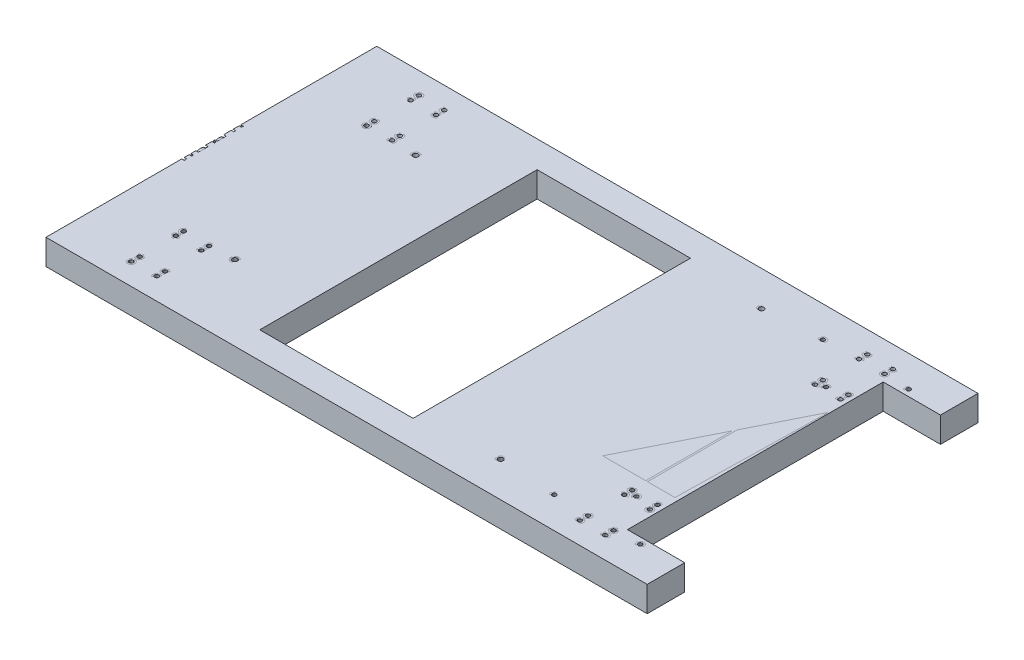
from build123d import *

# Parameters (mm, degrees)
SKETCH1_W                   = 600.075
SKETCH1_H                   = 330.2
BOSS_EXTRUDE1_DEPTH         = 25.4
CUT_EXTRUDE1_DEPTH          = 2.54
CUT_EXTRUDE2_DEPTH          = 2.54
CUT_EXTRUDE3_REACH          = 345.403
SKETCH4_W                   = 153.035
SKETCH4_H                   = 276.86
F_21_0_159_DIAMETER_HOLE1_D = 4.0386
MIRROR4_COPY_1_D            = 4.0386
MIRROR4_COPY_2_D            = 4.0386
F_5_0MM_DOWEL_HOLE2_D       = 5
CUT_EXTRUDE4_REACH          = 345.403
SKETCH18_W                  = 57.15
SKETCH18_H                  = 255.27
CUT_EXTRUDE5_DEPTH          = 12.7
CUT_EXTRUDE5_DEPTH_BACK     = 12.7
SKETCH19_R                  = 2.032
CUT_EXTRUDE6_REACH          = 345.403
SKETCH20_R                  = 2.0193
CUT_EXTRUDE7_REACH          = 345.403
SKETCH21_R                  = 2.0193
LPATTERN1_COUNT             = 2
LPATTERN1_PITCH             = 447.675
MIRROR5_COPY_1_REACH        = 345.403
MIRROR5_COPY_1_SKETCH_R     = 2.0193
MIRROR5_COPY_2_REACH        = 345.403
MIRROR5_COPY_2_SKETCH_R     = 2.0193
MIRROR5_COPY_3_REACH        = 345.403
MIRROR5_COPY_3_SKETCH_R     = 2.0193
MIRROR5_COPY_4_REACH        = 345.403
MIRROR5_COPY_4_SKETCH_R     = 2.0193
CUT_EXTRUDE8_REACH          = 345.403
SKETCH22_R                  = 2.032
SKETCH23_R                  = 3.6068
SKETCH23_R_2                = 2.0193
BOSS_EXTRUDE2_DEPTH         = 26.67
BOSS_EXTRUDE2_2_DEPTH       = 26.67
BOSS_EXTRUDE2_3_DEPTH       = 26.67
BOSS_EXTRUDE2_4_DEPTH       = 26.67
BOSS_EXTRUDE2_5_DEPTH       = 26.67
BOSS_EXTRUDE2_6_DEPTH       = 26.67
BOSS_EXTRUDE2_7_DEPTH       = 26.67
BOSS_EXTRUDE2_8_DEPTH       = 26.67
SKETCH23_R_3                = 4.08813
SKETCH23_R_4                = 2.50063
BOSS_EXTRUDE2_9_DEPTH       = 26.67
BOSS_EXTRUDE2_10_DEPTH      = 26.67
SKETCH23_R_5                = 3.6195
SKETCH23_R_6                = 2.032
BOSS_EXTRUDE2_11_DEPTH      = 26.67
BOSS_EXTRUDE2_12_DEPTH      = 26.67
BOSS_EXTRUDE2_13_DEPTH      = 26.67
BOSS_EXTRUDE2_14_DEPTH      = 26.67
BOSS_EXTRUDE2_15_DEPTH      = 26.67
BOSS_EXTRUDE2_16_DEPTH      = 26.67
BOSS_EXTRUDE2_17_DEPTH      = 26.67
BOSS_EXTRUDE2_18_DEPTH      = 26.67
BOSS_EXTRUDE2_19_DEPTH      = 26.67
BOSS_EXTRUDE2_20_DEPTH      = 26.67
BOSS_EXTRUDE2_21_DEPTH      = 26.67
SKETCH24_W                  = 76.2
SKETCH24_H                  = 152.4
BOSS_EXTRUDE3_DEPTH         = 25.4


with BuildPart() as part:
    # Sketch1 → Boss-Extrude1 (new body)
    with BuildSketch(Plane(origin=(0, 0, 0), x_dir=(1, 0, 0), z_dir=(0, 1, 0))):
        Rectangle(SKETCH1_W, SKETCH1_H)
    extrude(amount=BOSS_EXTRUDE1_DEPTH)

    # Sketch2 → Cut-Extrude1 (cut)
    # profile 1 of 4: a face of its own
    with BuildSketch(Plane.ZY.offset(300.0375)):
        with BuildLine():
            Line((-29.307692308, 31.75), (-25.590805288, 31.75))
            add(Edge.make_bspline(
                [(-25.590805288, 31.75), (-25.408858857, 31.749043416), (-25.056201391, 31.747189317), (-24.543378429, 31.718433989), (-24.06305276, 31.679225443), (-23.615085084, 31.617013082), (-23.199682404, 31.541946409), (-22.815592836, 31.45104081), (-22.464037755, 31.342038813), (-22.044324147, 31.168704053), (-21.56578455, 30.911130809), (-21.047633298, 30.530519618), (-20.604561653, 30.06497864), (-20.222547555, 29.53983733), (-19.918830032, 28.962155487), (-19.699105714, 28.345701902), (-19.559997849, 27.69842785), (-19.545691658, 27.254055696), (-19.538461538, 27.029477163)],
                knots=[0, 0, 0, 0, 1.001505555, 1.941167018, 2.826882275, 3.653841531, 4.429895133, 5.150066043, 5.825578002, 6.45369114, 7.647487171, 8.808567382, 9.977351308, 11.170798116, 12.373658725, 13.556498008, 14.765093433, 16, 16, 16, 16], degree=3))
            add(Edge.make_bspline(
                [(-19.538461538, 27.029477163), (-19.54441177, 26.819096825), (-19.556104537, 26.405679619), (-19.667915841, 25.801010253), (-19.842961765, 25.225421476), (-20.08628605, 24.681013921), (-20.402526915, 24.180088113), (-20.777312907, 23.718603136), (-21.229488074, 23.316098097), (-21.568269138, 23.091074585), (-21.740354567, 22.976772837)],
                knots=[0, 0, 0, 0, 1.044552857, 2.05264487, 3.044412934, 4.028983338, 5.005914585, 5.980388656, 6.974128949, 8, 8, 8, 8], degree=3))
            add(Edge.make_bspline(
                [(-21.740354567, 22.976772837), (-21.52394424, 22.893687628), (-21.109897675, 22.734725042), (-20.540106664, 22.453680588), (-20.049189008, 22.147998245), (-19.633370256, 21.814177746), (-19.277746735, 21.454356933), (-18.967215724, 21.063259811), (-18.702249959, 20.635784572), (-18.475212475, 20.176388187), (-18.298054246, 19.689761552), (-18.165379681, 19.180469185), (-18.08935685, 18.65033732), (-18.078538403, 18.289555469), (-18.073076923, 18.107421875)],
                knots=[0, 0, 0, 0, 1.27268992, 2.434971085, 3.483601985, 4.442670788, 5.356604649, 6.2567628, 7.179492994, 8.113709626, 9.066344395, 10.018646069, 10.999752585, 12, 12, 12, 12], degree=3))
            add(Edge.make_bspline(
                [(-18.073076923, 18.107421875), (-18.078393756, 17.921456471), (-18.088854775, 17.555564329), (-18.166034336, 17.018054239), (-18.296712475, 16.504384887), (-18.476714, 16.011233821), (-18.711640313, 15.539555089), (-18.997542519, 15.088814324), (-19.338437172, 14.663540324), (-19.719779359, 14.259007461), (-20.151191894, 13.895273362), (-20.616641931, 13.571337873), (-21.121991186, 13.304931449), (-21.658939897, 13.081142817), (-22.233511389, 12.910197923), (-22.84312558, 12.790604342), (-23.487256709, 12.710022641), (-23.929269783, 12.703397568), (-24.155949519, 12.7)],
                knots=[0, 0, 0, 0, 0.978564426, 1.925352924, 2.850884081, 3.763762016, 4.682927383, 5.618979971, 6.567305752, 7.547517671, 8.540179244, 9.531824382, 10.526200242, 11.540722885, 12.589160233, 13.674978461, 14.80764778, 16, 16, 16, 16], degree=3))
            Line((-24.155949519, 12.7), (-29.307692308, 12.7))
            Line((-29.307692308, 12.7), (-29.307692308, 31.75))
        make_face()
        with BuildLine():
            Line((-27.598076923, 29.796153846), (-27.598076923, 23.690384615))
            Line((-27.598076923, 23.690384615), (-26.449429087, 23.690384615))
            add(Edge.make_bspline(
                [(-26.449429087, 23.690384615), (-26.2815235, 23.692561339), (-25.957095691, 23.696767213), (-25.487268825, 23.70881507), (-25.051159798, 23.742550135), (-24.649521392, 23.776275504), (-24.28298609, 23.831110046), (-23.952365929, 23.896381458), (-23.652472137, 23.965412698), (-23.306635468, 24.082812334), (-22.914352706, 24.256317966), (-22.496161096, 24.525586103), (-22.127492054, 24.846302939), (-21.816175933, 25.216368031), (-21.561387786, 25.623853986), (-21.384420279, 26.062259149), (-21.264420061, 26.520657296), (-21.25358044, 26.835353787), (-21.248076923, 26.995132212)],
                knots=[0, 0, 0, 0, 1.156816544, 2.235205308, 3.236616184, 4.169592532, 5.011045266, 5.787822928, 6.49130361, 7.128639758, 8.301311294, 9.436451833, 10.541879658, 11.654887649, 12.756523258, 13.837046038, 14.901820046, 16, 16, 16, 16], degree=3))
            add(Edge.make_bspline(
                [(-21.248076923, 26.995132212), (-21.250940847, 27.100863911), (-21.256558745, 27.308268185), (-21.302568864, 27.610615384), (-21.380769519, 27.894970665), (-21.481213601, 28.165230894), (-21.621577749, 28.412945393), (-21.786841743, 28.646679073), (-21.986516714, 28.858472175), (-22.213795801, 29.056426159), (-22.475099877, 29.231928517), (-22.770273051, 29.385638957), (-23.103308837, 29.509413755), (-23.468594519, 29.617814528), (-23.871752866, 29.693950813), (-24.308131507, 29.757378537), (-24.781304763, 29.789669604), (-25.108665964, 29.793944222), (-25.277884615, 29.796153846)],
                knots=[0, 0, 0, 0, 0.91205012, 1.789085906, 2.630437955, 3.453916878, 4.269457761, 5.079663411, 5.91843418, 6.774407191, 7.675494373, 8.627863946, 9.638891023, 10.736472738, 11.911756761, 13.175263542, 14.539845004, 16, 16, 16, 16], degree=3))
            Line((-25.277884615, 29.796153846), (-27.598076923, 29.796153846))
        make_face(mode=Mode.SUBTRACT)
        with BuildLine():
            Line((-27.598076923, 21.736538462), (-27.598076923, 14.653846154))
            Line((-27.598076923, 14.653846154), (-25.163401442, 14.653846154))
            add(Edge.make_bspline(
                [(-25.163401442, 14.653846154), (-24.989127003, 14.655934836), (-24.653235995, 14.659960496), (-24.168270728, 14.673102571), (-23.718782692, 14.702996243), (-23.306822982, 14.750054368), (-22.927943233, 14.801099927), (-22.586688592, 14.869741327), (-22.280292782, 14.948384955), (-21.92501405, 15.069946664), (-21.524944954, 15.258794599), (-21.093811579, 15.54353346), (-20.710491735, 15.882750321), (-20.384980252, 16.275348582), (-20.118209558, 16.70223909), (-19.924142009, 17.154787352), (-19.804448918, 17.625515723), (-19.78995911, 17.946463115), (-19.782692308, 18.107421875)],
                knots=[0, 0, 0, 0, 1.160039823, 2.235823828, 3.228722157, 4.157150951, 4.99529583, 5.772374946, 6.472645482, 7.099169577, 8.269452708, 9.405989375, 10.527446681, 11.663510218, 12.788923519, 13.866172445, 14.929861265, 16, 16, 16, 16], degree=3))
            add(Edge.make_bspline(
                [(-19.782692308, 18.107421875), (-19.784195104, 18.208078486), (-19.787176457, 18.407768106), (-19.832137804, 18.701224208), (-19.897527581, 18.985482176), (-19.982062957, 19.261313877), (-20.105177485, 19.523732397), (-20.248904537, 19.777927757), (-20.417423023, 20.024235981), (-20.680009126, 20.335634103), (-21.061945213, 20.694410988), (-21.604634948, 21.045679393), (-22.22170417, 21.328968171), (-22.669256667, 21.449252464), (-22.900450721, 21.511388221)],
                knots=[0, 0, 0, 0, 0.723448775, 1.435228256, 2.130040452, 2.821711965, 3.505591119, 4.210454504, 4.921174351, 5.648778258, 7.137944449, 8.670945889, 10.280296675, 12, 12, 12, 12], degree=3))
            add(Edge.make_bspline(
                [(-22.900450721, 21.511388221), (-22.993137657, 21.53019375), (-23.194102053, 21.570968014), (-23.521803312, 21.614008514), (-23.895922827, 21.652353768), (-24.317324487, 21.680717355), (-24.786541451, 21.710035542), (-25.304575823, 21.721437354), (-25.869312064, 21.73504047), (-26.261156262, 21.736026358), (-26.46469351, 21.736538462)],
                knots=[0, 0, 0, 0, 0.634451884, 1.375622551, 2.216452059, 3.157844607, 4.20941857, 5.370758133, 6.634282058, 8, 8, 8, 8], degree=3))
            Line((-26.46469351, 21.736538462), (-27.598076923, 21.736538462))
        make_face(mode=Mode.SUBTRACT)
    # profile 2 of 4: a face of its own
    with BuildSketch(Plane.ZY.offset(300.0375)):
        with BuildLine():
            Line((-0.488461538, 26.621153846), (-0.488461538, 12.7))
            Line((-0.488461538, 12.7), (-2.198076923, 12.7))
            Line((-2.198076923, 12.7), (-2.198076923, 15.10796274))
            add(Edge.make_bspline(
                [(-2.198076923, 15.10796274), (-2.390856341, 14.89003295), (-2.767067798, 14.464740225), (-3.395397312, 13.909121543), (-4.061429823, 13.449862393), (-4.761932728, 13.078932138), (-5.496273452, 12.800301088), (-6.262824156, 12.602256422), (-7.061897529, 12.474927119), (-7.607556774, 12.462212486), (-7.884074519, 12.455769231)],
                knots=[0, 0, 0, 0, 1.074387032, 2.096679803, 3.090159297, 4.057316773, 5.018401886, 5.985159533, 6.978961417, 8, 8, 8, 8], degree=3))
            add(Edge.make_bspline(
                [(-7.884074519, 12.455769231), (-8.129917239, 12.4624442), (-8.614729969, 12.475607534), (-9.327902517, 12.577728073), (-10.014204618, 12.741724742), (-10.674284792, 12.969785298), (-11.303871755, 13.27230377), (-11.908355995, 13.634478277), (-12.484605933, 14.065774795), (-13.023838167, 14.558832492), (-13.520400912, 15.094382351), (-13.956162981, 15.66558597), (-14.319490459, 16.269973367), (-14.623311184, 16.89989239), (-14.857334144, 17.560192167), (-15.020476354, 18.248589324), (-15.122477928, 18.964269921), (-15.135635821, 19.451620754), (-15.142307692, 19.698737981)],
                knots=[0, 0, 0, 0, 1.033919861, 2.038935746, 3.024066025, 3.998881131, 4.97069526, 5.957263378, 6.95902576, 7.993208707, 9.027059324, 10.027763471, 11.009749337, 11.988697705, 12.965288445, 13.950418724, 14.960734635, 16, 16, 16, 16], degree=3))
            add(Edge.make_bspline(
                [(-15.142307692, 19.698737981), (-15.135487948, 19.940747567), (-15.122005682, 20.419187465), (-15.021567442, 21.122832949), (-14.852670095, 21.800568054), (-14.615645381, 22.450210845), (-14.311705598, 23.072547404), (-13.941982724, 23.668017883), (-13.50645006, 24.238262746), (-13.004333387, 24.769873281), (-12.46040271, 25.260931195), (-11.87851376, 25.687700429), (-11.273141329, 26.056273563), (-10.634895514, 26.34830177), (-9.97322313, 26.584571324), (-9.282233661, 26.748036479), (-8.564802068, 26.844360471), (-8.077718104, 26.85830923), (-7.830649038, 26.865384615)],
                knots=[0, 0, 0, 0, 1.020392517, 2.01726096, 2.990465484, 3.961182959, 4.928053699, 5.906110375, 6.912531644, 7.948652711, 8.985773172, 9.998621852, 10.987621588, 11.969261332, 12.953316658, 13.946091881, 14.958173133, 16, 16, 16, 16], degree=3))
            add(Edge.make_bspline(
                [(-7.830649038, 26.865384615), (-7.546532663, 26.857559139), (-6.989393859, 26.84221375), (-6.174445694, 26.714509477), (-5.403495036, 26.498762962), (-4.670590634, 26.205297723), (-3.978364329, 25.815323926), (-3.333369514, 25.32339871), (-2.728855955, 24.732624535), (-2.378443224, 24.278851116), (-2.198076923, 24.045282452)],
                knots=[0, 0, 0, 0, 1.038897134, 2.037228247, 3.008116434, 3.962042015, 4.918381754, 5.904844433, 6.921570401, 8, 8, 8, 8], degree=3))
            Line((-2.198076923, 24.045282452), (-2.198076923, 26.621153846))
            Line((-2.198076923, 26.621153846), (-0.488461538, 26.621153846))
        make_face()
        with BuildLine():
            add(Edge.make_bspline(
                [(-7.807752404, 25.155769231), (-8.057657586, 25.146877574), (-8.550930666, 25.129326858), (-9.275070162, 24.99231112), (-9.968018888, 24.764339256), (-10.626311092, 24.452562051), (-11.2395481, 24.060519928), (-11.787609365, 23.586330684), (-12.274977497, 23.042932079), (-12.684869621, 22.432776306), (-13.019009325, 21.778664125), (-13.253961313, 21.094908255), (-13.40891536, 20.393841163), (-13.424746022, 19.918338544), (-13.432692308, 19.679657452)],
                knots=[0, 0, 0, 0, 1.031046209, 2.035121221, 3.029706178, 4.034933723, 5.034054252, 6.02443088, 7.017295772, 8.038157696, 9.050218397, 10.03989886, 11.016116709, 12, 12, 12, 12], degree=3))
            add(Edge.make_bspline(
                [(-13.432692308, 19.679657452), (-13.42254196, 19.442402726), (-13.40228105, 18.968823232), (-13.256680842, 18.266800378), (-13.012406102, 17.582883378), (-12.679074304, 16.922877113), (-12.261679961, 16.310097938), (-11.777871723, 15.756340985), (-11.222970906, 15.280147655), (-10.608322618, 14.881526004), (-9.951870665, 14.559512855), (-9.261531695, 14.33545416), (-8.550282864, 14.190795097), (-8.066672304, 14.173897873), (-7.823016827, 14.165384615)],
                knots=[0, 0, 0, 0, 0.979072187, 1.954306742, 2.945804271, 3.96968567, 4.997920485, 5.998718438, 6.996577872, 8.005894225, 9.015743152, 10.005417472, 10.995077863, 12, 12, 12, 12], degree=3))
            add(Edge.make_bspline(
                [(-7.823016827, 14.165384615), (-7.575658005, 14.174419562), (-7.083685841, 14.192389174), (-6.357398017, 14.32999149), (-5.652575433, 14.557333092), (-4.978819233, 14.872469768), (-4.351170005, 15.263034805), (-3.787845843, 15.7202734), (-3.311508929, 16.252057874), (-2.907689154, 16.836492568), (-2.591048672, 17.477182149), (-2.360401835, 18.159358244), (-2.224037005, 18.883044602), (-2.206849934, 19.377603976), (-2.198076923, 19.630048077)],
                knots=[0, 0, 0, 0, 1.01762866, 2.023962475, 3.030623092, 4.058876274, 5.077231937, 6.066672613, 7.034107872, 8.005628644, 8.981990164, 9.965428785, 10.961468474, 12, 12, 12, 12], degree=3))
            add(Edge.make_bspline(
                [(-2.198076923, 19.630048077), (-2.203300196, 19.82238684), (-2.213581249, 20.200970393), (-2.292124777, 20.756835882), (-2.417065163, 21.28878659), (-2.593120745, 21.797381798), (-2.824394736, 22.279809525), (-3.103329005, 22.739533705), (-3.434828667, 23.174163327), (-3.813557341, 23.577713471), (-4.228113658, 23.945794644), (-4.666778229, 24.274348583), (-5.134748266, 24.544253188), (-5.624153853, 24.767634966), (-6.135844116, 24.945394053), (-6.673982775, 25.063981358), (-7.232849833, 25.145408248), (-7.614100506, 25.152279207), (-7.807752404, 25.155769231)],
                knots=[0, 0, 0, 0, 1.050140795, 2.067009409, 3.05949893, 4.030605086, 5.00011959, 5.97591094, 6.962425594, 7.979863591, 8.993523472, 9.986985069, 10.967611495, 11.937549037, 12.921786183, 13.919465291, 14.943216303, 16, 16, 16, 16], degree=3))
        make_face(mode=Mode.SUBTRACT)
    # profile 3 of 4: a face of its own
    with BuildSketch(Plane.ZY.offset(300.0375)):
        with BuildLine():
            Line((17.096153846, 23.602614183), (15.665114183, 22.713461538))
            add(Edge.make_bspline(
                [(15.665114183, 22.713461538), (15.508197344, 22.908470368), (15.199333188, 23.29231214), (14.662998202, 23.787666205), (14.091436076, 24.213118247), (13.474879845, 24.559848662), (12.814194276, 24.827753985), (12.111984871, 25.017329818), (11.368351766, 25.135462911), (10.858545469, 25.148889552), (10.597325721, 25.155769231)],
                knots=[0, 0, 0, 0, 1.026593902, 2.0206758, 2.988051866, 3.946915611, 4.916868779, 5.907761954, 6.927957743, 8, 8, 8, 8], degree=3))
            add(Edge.make_bspline(
                [(10.597325721, 25.155769231), (10.388543399, 25.15001699), (9.977352291, 25.138688107), (9.373705942, 25.06787385), (8.798709705, 24.939193777), (8.248759561, 24.769643569), (7.727766997, 24.542402706), (7.234366998, 24.265852462), (6.764183117, 23.944451528), (6.330840568, 23.572102702), (5.934442686, 23.167161383), (5.591004311, 22.733073412), (5.291990432, 22.282840861), (5.05737087, 21.805220664), (4.865373156, 21.311139575), (4.739062293, 20.791271303), (4.654890166, 20.252276005), (4.645259963, 19.884783327), (4.640384615, 19.698737981)],
                knots=[0, 0, 0, 0, 1.112346261, 2.190735716, 3.231507886, 4.247384806, 5.251966152, 6.253067467, 7.256802811, 8.280671706, 9.291813951, 10.270744147, 11.225547591, 12.165006084, 13.100104208, 14.043489273, 15.009504848, 16, 16, 16, 16], degree=3))
            add(Edge.make_bspline(
                [(4.640384615, 19.698737981), (4.650068831, 19.455065561), (4.669306776, 18.971003995), (4.820081864, 18.256476041), (5.066884995, 17.565648526), (5.404657011, 16.903426237), (5.831796842, 16.290592335), (6.333478937, 15.740953819), (6.909981376, 15.265160865), (7.55622449, 14.870703265), (8.257034494, 14.553594964), (9.004829207, 14.32767648), (9.793498012, 14.191319996), (10.333466164, 14.174142648), (10.608774038, 14.165384615)],
                knots=[0, 0, 0, 0, 0.966302908, 1.919585723, 2.883856336, 3.870342332, 4.860282998, 5.839159637, 6.814385684, 7.815993281, 8.834850808, 9.858348828, 10.908058873, 12, 12, 12, 12], degree=3))
            add(Edge.make_bspline(
                [(10.608774038, 14.165384615), (10.861078685, 14.172457593), (11.356924268, 14.186357871), (12.081734777, 14.303536943), (12.77177972, 14.495363006), (13.427034572, 14.762866644), (14.046301991, 15.108637837), (14.625580785, 15.53513561), (15.176397592, 16.030090535), (15.500231136, 16.412821207), (15.665114183, 16.607692308)],
                knots=[0, 0, 0, 0, 1.039848629, 2.043578496, 3.018386758, 3.987534228, 4.954977003, 5.934852016, 6.948509513, 8, 8, 8, 8], degree=3))
            Line((15.665114183, 16.607692308), (17.096153846, 15.668930288))
            add(Edge.make_bspline(
                [(17.096153846, 15.668930288), (17.01131221, 15.544339332), (16.841910537, 15.295570952), (16.558731604, 14.944810831), (16.253279378, 14.616488532), (15.926745522, 14.311044151), (15.583393711, 14.021168361), (15.21149466, 13.760719077), (14.823040061, 13.515056685), (14.413469645, 13.294006623), (13.987017989, 13.09530793), (13.544285159, 12.924450272), (13.087195036, 12.777655839), (12.615210189, 12.660975423), (12.127400113, 12.567843573), (11.625026389, 12.506046998), (11.108262038, 12.459917253), (10.758982186, 12.457163892), (10.582061298, 12.455769231)],
                knots=[0, 0, 0, 0, 0.954134338, 1.905101784, 2.851144739, 3.791306361, 4.734911809, 5.6936923, 6.663572882, 7.643865596, 8.638447847, 9.640600242, 10.646758161, 11.676244097, 12.717260333, 13.78922464, 14.880174919, 16, 16, 16, 16], degree=3))
            add(Edge.make_bspline(
                [(10.582061298, 12.455769231), (10.312036345, 12.460620339), (9.782785478, 12.470128548), (9.008144401, 12.574677535), (8.267841441, 12.732289704), (7.562129521, 12.95851517), (6.890898775, 13.249734018), (6.254775089, 13.605462367), (5.655864761, 14.028654252), (5.100090358, 14.511777326), (4.589651344, 15.035601386), (4.151358793, 15.600841653), (3.771200963, 16.186716499), (3.465924479, 16.806165491), (3.222917636, 17.45095559), (3.05688419, 18.126252182), (2.949498047, 18.826488022), (2.937069938, 19.304005566), (2.930769231, 19.54609375)],
                knots=[0, 0, 0, 0, 1.1129367, 2.181364009, 3.217532258, 4.231199276, 5.232079859, 6.230262199, 7.231623845, 8.250719726, 9.263571943, 10.242672461, 11.195837495, 12.138959767, 13.085126421, 14.0317438, 15.002148558, 16, 16, 16, 16], degree=3))
            add(Edge.make_bspline(
                [(2.930769231, 19.54609375), (2.933169619, 19.710350658), (2.937944386, 20.037084759), (2.992710021, 20.522016479), (3.063458853, 21.000490133), (3.183341793, 21.46644072), (3.321811517, 21.926935227), (3.498571197, 22.37642325), (3.705918989, 22.816993541), (3.94133316, 23.247511183), (4.206339044, 23.660893677), (4.499606899, 24.051438623), (4.810091072, 24.423837632), (5.152316767, 24.765234101), (5.511761169, 25.089281085), (5.898593602, 25.387321733), (6.310595309, 25.660231984), (6.741578822, 25.913058225), (7.191293322, 26.138171722), (7.657020485, 26.332118345), (8.135953973, 26.497867365), (8.628859901, 26.629088769), (9.132466643, 26.739129316), (9.650742783, 26.808350736), (10.181705592, 26.857261736), (10.541239087, 26.862654476), (10.723257212, 26.865384615)],
                knots=[0, 0, 0, 0, 0.990994727, 1.971252077, 2.943264845, 3.907940874, 4.872158414, 5.844625996, 6.82015047, 7.809835459, 8.804511986, 9.781214284, 10.756496977, 11.728388426, 12.696359165, 13.676225489, 14.672885716, 15.677705647, 16.690706858, 17.706033469, 18.721040654, 19.747369689, 20.783475414, 21.830280724, 22.901553713, 24, 24, 24, 24], degree=3))
            add(Edge.make_bspline(
                [(10.723257212, 26.865384615), (10.951204657, 26.860366894), (11.405960159, 26.850356532), (12.080551719, 26.766108439), (12.745207275, 26.639091659), (13.388265081, 26.450916685), (14.001928252, 26.223058788), (14.576342631, 25.967175299), (15.097986625, 25.670024672), (15.576563932, 25.344976621), (16.01296959, 24.978340834), (16.411683328, 24.565734395), (16.780881305, 24.109304673), (16.990195691, 23.772904907), (17.096153846, 23.602614183)],
                knots=[0, 0, 0, 0, 1.095225653, 2.184976855, 3.262915854, 4.344593502, 5.400796181, 6.407717688, 7.363229445, 8.282371371, 9.184954523, 10.097238608, 11.036792983, 12, 12, 12, 12], degree=3))
        make_face()
    # profile 4 of 4: a face of its own
    with BuildSketch(Plane.ZY.offset(300.0375)):
        Polygon((20.515384615, 32.238461538), (22.225, 32.238461538), (22.225, 20.942788462), (28.559735577, 26.621153846), (31.017307692, 26.621153846), (23.667487981, 20.026923077), (31.75, 12.7), (29.29624399, 12.7), (22.225, 19.114873798), (22.225, 12.7), (20.515384615, 12.7), align=None)
    extrude(amount=-CUT_EXTRUDE1_DEPTH, mode=Mode.SUBTRACT)

    # Sketch3 → Cut-Extrude2 (cut)
    # profile 1 of 5: a face of its own
    with BuildSketch(Plane(origin=(300.0375, 0, 0), x_dir=(0, 0, -1), z_dir=(1, 0, 0))):
        Polygon((-28.941346154, 31.75), (-19.660576923, 31.75), (-19.660576923, 29.796153846), (-27.231730769, 29.796153846), (-27.231730769, 23.934615385), (-19.660576923, 23.934615385), (-19.660576923, 21.980769231), (-27.231730769, 21.980769231), (-27.231730769, 12.7), (-28.941346154, 12.7), align=None)
    # profile 2 of 5: a face of its own
    with BuildSketch(Plane(origin=(300.0375, 0, 0), x_dir=(0, 0, -1), z_dir=(1, 0, 0))):
        with BuildLine():
            Line((-17.218269231, 26.621153846), (-15.508653846, 26.621153846))
            Line((-15.508653846, 26.621153846), (-15.508653846, 24.571905048))
            add(Edge.make_bspline(
                [(-15.508653846, 24.571905048), (-15.382440745, 24.762708914), (-15.14105917, 25.127619824), (-14.739850226, 25.610234162), (-14.32889638, 26.009821773), (-13.906230289, 26.328248068), (-13.468743773, 26.566716615), (-13.026038365, 26.74139442), (-12.571149022, 26.844685236), (-12.265467691, 26.858475579), (-12.112319712, 26.865384615)],
                knots=[0, 0, 0, 0, 1.2804753, 2.448899062, 3.506932113, 4.484331642, 5.4025378, 6.288909075, 7.142734305, 8, 8, 8, 8], degree=3))
            add(Edge.make_bspline(
                [(-12.112319712, 26.865384615), (-11.993522135, 26.858904749), (-11.749088399, 26.845572003), (-11.379068875, 26.751895944), (-10.997832372, 26.602336992), (-10.752128807, 26.461692352), (-10.624038462, 26.388371394)],
                knots=[0, 0, 0, 0, 0.901110191, 1.854092781, 2.881294221, 4, 4, 4, 4], degree=3))
            Line((-10.624038462, 26.388371394), (-11.562800481, 24.907722356))
            add(Edge.make_bspline(
                [(-11.562800481, 24.907722356), (-11.645036724, 24.944408661), (-11.801136858, 25.014046292), (-12.029489568, 25.09646209), (-12.240026558, 25.144990147), (-12.374157926, 25.152341909), (-12.436688702, 25.155769231)],
                knots=[0, 0, 0, 0, 1.180555205, 2.24091978, 3.179933427, 4, 4, 4, 4], degree=3))
            add(Edge.make_bspline(
                [(-12.436688702, 25.155769231), (-12.573879909, 25.146625027), (-12.853710203, 25.127973503), (-13.264561549, 24.981349421), (-13.663235625, 24.744447757), (-13.979855673, 24.481714991), (-14.225014221, 24.228361979), (-14.399948877, 24.007118531), (-14.560419257, 23.75904055), (-14.713745742, 23.488368986), (-14.853443715, 23.190482252), (-14.983825557, 22.868356476), (-15.101711654, 22.521618561), (-15.168932269, 22.280050844), (-15.203365385, 22.156310096)],
                knots=[0, 0, 0, 0, 1.125678352, 2.296057538, 3.5422874, 4.923748041, 5.663163013, 6.437101912, 7.23742474, 8.08941207, 8.991984279, 9.93940061, 10.944477711, 12, 12, 12, 12], degree=3))
            add(Edge.make_bspline(
                [(-15.203365385, 22.156310096), (-15.229123126, 22.045944337), (-15.286174565, 21.801492567), (-15.341645649, 21.391381311), (-15.396452597, 20.906838254), (-15.435078477, 20.346514656), (-15.470881821, 19.711809783), (-15.491075268, 19.001756707), (-15.507965219, 18.21562661), (-15.50841734, 17.66603763), (-15.508653846, 17.378545673)],
                knots=[0, 0, 0, 0, 0.566838948, 1.255505196, 2.06880316, 3.007127437, 4.065329342, 5.249902469, 6.561414163, 8, 8, 8, 8], degree=3))
            Line((-15.508653846, 17.378545673), (-15.508653846, 12.7))
            Line((-15.508653846, 12.7), (-17.218269231, 12.7))
            Line((-17.218269231, 12.7), (-17.218269231, 26.621153846))
        make_face()
    # profile 3 of 5: a face of its own
    with BuildSketch(Plane(origin=(300.0375, 0, 0), x_dir=(0, 0, -1), z_dir=(1, 0, 0))):
        with BuildLine():
            add(Edge.make_bspline(
                [(-2.190444712, 26.865384615), (-1.929235069, 26.859822608), (-1.417066797, 26.848916871), (-0.666998161, 26.732358272), (0.048983221, 26.554119046), (0.733619496, 26.307712401), (1.378142475, 25.977429213), (1.991940247, 25.583315785), (2.573329967, 25.116413383), (2.921798169, 24.755235897), (3.098677885, 24.571905048)],
                knots=[0, 0, 0, 0, 1.054011418, 2.066658804, 3.057071809, 4.030435133, 4.997543892, 5.974964718, 6.972108034, 8, 8, 8, 8], degree=3))
            add(Edge.make_bspline(
                [(3.098677885, 24.571905048), (3.250979663, 24.396568925), (3.552635761, 24.049289917), (3.939436316, 23.486195795), (4.272656522, 22.903047533), (4.53969921, 22.29210137), (4.750256268, 21.658690659), (4.899748129, 21.000638284), (4.988667732, 20.319397509), (5.000658166, 19.856733762), (5.006730769, 19.622415865)],
                knots=[0, 0, 0, 0, 1.025258237, 2.030674902, 3.01204498, 3.988269485, 4.97094183, 5.956517959, 6.965070386, 8, 8, 8, 8], degree=3))
            add(Edge.make_bspline(
                [(5.006730769, 19.622415865), (5.00138949, 19.386739837), (4.990834874, 18.921033014), (4.890993191, 18.235127609), (4.735702566, 17.570038646), (4.513460704, 16.928550613), (4.228482995, 16.308702652), (3.88073511, 15.713202105), (3.467776737, 15.140874065), (2.999669269, 14.596578346), (2.482315486, 14.094930805), (1.921069021, 13.65771551), (1.326959209, 13.283129784), (0.6920861, 12.981397293), (0.022247351, 12.743491639), (-0.684001834, 12.576395835), (-1.425564288, 12.475367242), (-1.931898165, 12.462393793), (-2.190444712, 12.455769231)],
                knots=[0, 0, 0, 0, 0.998656419, 1.973391657, 2.932242238, 3.890759089, 4.846373663, 5.82037756, 6.809684879, 7.83454468, 8.860553229, 9.859544525, 10.845671541, 11.83227036, 12.833544569, 13.85385346, 14.904124723, 16, 16, 16, 16], degree=3))
            add(Edge.make_bspline(
                [(-2.190444712, 12.455769231), (-2.450257971, 12.462416027), (-2.959115364, 12.475434114), (-3.703295352, 12.576003324), (-4.410810277, 12.74341463), (-5.081525935, 12.982179126), (-5.719128602, 13.283139428), (-6.316680821, 13.656583053), (-6.878383219, 14.095060469), (-7.395846448, 14.596543212), (-7.863924571, 15.140883117), (-8.276890517, 15.713199756), (-8.624636435, 16.308703264), (-8.909614659, 16.928550449), (-9.131856383, 17.570038689), (-9.287147045, 18.235127597), (-9.386988718, 18.921033017), (-9.397543336, 19.386739838), (-9.402884615, 19.622415865)],
                knots=[0, 0, 0, 0, 1.099876186, 2.154163076, 3.173186993, 4.173200201, 5.163417411, 6.152872554, 7.150605724, 8.17532212, 9.198891216, 10.186952605, 11.159729845, 12.11414092, 13.071450619, 14.029093627, 15.002601286, 16, 16, 16, 16], degree=3))
            add(Edge.make_bspline(
                [(-9.402884615, 19.622415865), (-9.396770598, 19.855460208), (-9.384665893, 20.316847955), (-9.295835694, 20.9968081), (-9.146926979, 21.653746746), (-8.936117521, 22.284712551), (-8.666613411, 22.892981424), (-8.338075544, 23.477570576), (-7.947329387, 24.038118461), (-7.64687305, 24.38494864), (-7.494831731, 24.560456731)],
                knots=[0, 0, 0, 0, 1.031353054, 2.041901799, 3.029428768, 4.008703097, 4.981709435, 5.96992636, 6.972712378, 8, 8, 8, 8], degree=3))
            add(Edge.make_bspline(
                [(-7.494831731, 24.560456731), (-7.318218685, 24.745377472), (-6.970878055, 25.109056647), (-6.386594265, 25.574597956), (-5.774306468, 25.976912587), (-5.122660798, 26.300633131), (-4.438586957, 26.555568492), (-3.718936509, 26.732817938), (-2.966322632, 26.848496913), (-2.451648122, 26.859699281), (-2.190444712, 26.865384615)],
                knots=[0, 0, 0, 0, 1.027980169, 2.021703884, 2.998553061, 3.971491411, 4.943284454, 5.930300938, 6.949603206, 8, 8, 8, 8], degree=3))
        make_face()
        with BuildLine():
            add(Edge.make_bspline(
                [(-2.198076923, 25.155769231), (-2.382794493, 25.150519096), (-2.747461179, 25.140154358), (-3.28423349, 25.061320534), (-3.800979185, 24.936420547), (-4.298678637, 24.758961327), (-4.775653475, 24.529823034), (-5.232360366, 24.248381817), (-5.670142646, 23.918365296), (-6.080436448, 23.540289898), (-6.45698589, 23.127291371), (-6.786158877, 22.687245303), (-7.066058384, 22.227289333), (-7.299231249, 21.746945155), (-7.472897516, 21.241345016), (-7.599024967, 20.716214723), (-7.677784418, 20.170484385), (-7.688051708, 19.7994937), (-7.693269231, 19.610967548)],
                knots=[0, 0, 0, 0, 1.021534396, 2.016698045, 2.994645724, 3.958388632, 4.93408049, 5.916473867, 6.921342795, 7.962252576, 8.998418191, 10.008913653, 10.997312074, 11.973003931, 12.956656626, 13.948281152, 14.957379055, 16, 16, 16, 16], degree=3))
            add(Edge.make_bspline(
                [(-7.693269231, 19.610967548), (-7.684523519, 19.367388657), (-7.667164917, 18.883930107), (-7.52600313, 18.171943854), (-7.289857807, 17.488419773), (-6.970975613, 16.837364872), (-6.571436052, 16.234991473), (-6.100699303, 15.69793668), (-5.563817505, 15.234282477), (-4.967190554, 14.849576732), (-4.32300491, 14.543907205), (-3.641252648, 14.327287066), (-2.930194013, 14.18647114), (-2.444251748, 14.172474972), (-2.198076923, 14.165384615)],
                knots=[0, 0, 0, 0, 1.016792936, 2.018143844, 3.017858371, 4.030088057, 5.03801393, 6.028138512, 7.003788237, 7.991172063, 8.984598303, 9.972568034, 10.972917682, 12, 12, 12, 12], degree=3))
            add(Edge.make_bspline(
                [(-2.198076923, 14.165384615), (-1.951916258, 14.172516284), (-1.466001943, 14.186593999), (-0.75593128, 14.32657786), (-0.076042376, 14.544856357), (0.567474176, 14.849232956), (1.163829546, 15.235743385), (1.704572621, 15.695318523), (2.171290061, 16.236413914), (2.570434397, 16.838162749), (2.89453881, 17.487410437), (3.129578809, 18.172070008), (3.271079955, 18.883897979), (3.288392751, 19.367377893), (3.297115385, 19.610967548)],
                knots=[0, 0, 0, 0, 1.02726834, 2.027799167, 3.010890988, 4.004497153, 4.992059811, 5.971914811, 6.958719428, 7.966827853, 8.981595046, 9.981490638, 10.983022906, 12, 12, 12, 12], degree=3))
            add(Edge.make_bspline(
                [(3.297115385, 19.610967548), (3.291899658, 19.799494826), (3.281635904, 20.170487729), (3.20285074, 20.716201941), (3.076818446, 21.241391917), (2.902801501, 21.746772106), (2.670641797, 22.228533022), (2.38534468, 22.685894822), (2.057515813, 23.128815737), (1.676422626, 23.538954839), (1.266557098, 23.918512681), (0.82859739, 24.248509786), (0.372567721, 24.528586128), (-0.103021421, 24.760921237), (-0.600784682, 24.934806047), (-1.116806343, 25.062041712), (-1.651288437, 25.139821211), (-2.014648372, 25.150419224), (-2.198076923, 25.155769231)],
                knots=[0, 0, 0, 0, 1.042956736, 2.052379634, 3.044323526, 4.02829302, 5.004299113, 5.996692471, 7.007513377, 8.048758398, 9.090003419, 10.095195979, 11.07790575, 12.047570684, 13.018257071, 13.989683339, 14.985167495, 16, 16, 16, 16], degree=3))
        make_face(mode=Mode.SUBTRACT)
    # profile 4 of 5: a face of its own
    with BuildSketch(Plane(origin=(300.0375, 0, 0), x_dir=(0, 0, -1), z_dir=(1, 0, 0))):
        with BuildLine():
            Line((8.425961538, 26.621153846), (10.135576923, 26.621153846))
            Line((10.135576923, 26.621153846), (10.135576923, 24.11015625))
            add(Edge.make_bspline(
                [(10.135576923, 24.11015625), (10.31811748, 24.337900213), (10.672343799, 24.779845318), (11.262264242, 25.36071016), (11.885710328, 25.839383456), (12.53886409, 26.220948392), (13.222612188, 26.508585029), (13.932786771, 26.716316739), (14.673639671, 26.840875592), (15.177454678, 26.857150988), (15.432331731, 26.865384615)],
                knots=[0, 0, 0, 0, 1.12780773, 2.188550248, 3.19190651, 4.159438251, 5.104880172, 6.052711206, 7.014878035, 8, 8, 8, 8], degree=3))
            add(Edge.make_bspline(
                [(15.432331731, 26.865384615), (15.689945611, 26.855885766), (16.194158114, 26.837294226), (16.928280134, 26.690246236), (17.613935319, 26.439084205), (18.248678902, 26.095029936), (18.820871306, 25.66718613), (19.323382283, 25.168741347), (19.739016529, 24.595412094), (20.017676462, 24.063518915), (20.201240345, 23.591684192), (20.316804925, 23.187569738), (20.414944981, 22.737346658), (20.500026352, 22.242375466), (20.557596061, 21.699188173), (20.603001962, 21.110011449), (20.635543141, 20.475036139), (20.636834225, 20.035870353), (20.6375, 19.809405048)],
                knots=[0, 0, 0, 0, 1.235846778, 2.418850247, 3.575807741, 4.728682307, 5.871620074, 6.994088408, 8.11269785, 9.256955736, 9.865816715, 10.540099792, 11.271859618, 12.076849838, 12.949306005, 13.892391288, 14.913166135, 16, 16, 16, 16], degree=3))
            Line((20.6375, 19.809405048), (20.6375, 12.7))
            Line((20.6375, 12.7), (18.927884615, 12.7))
            Line((18.927884615, 12.7), (18.927884615, 19.2484375))
            add(Edge.make_bspline(
                [(18.927884615, 19.2484375), (18.926833012, 19.437971093), (18.924821473, 19.8005166), (18.918477025, 20.319596569), (18.903183649, 20.79033066), (18.881693545, 21.211593474), (18.850239108, 21.582980499), (18.817458786, 21.905248134), (18.777372269, 22.177987215), (18.741651271, 22.342171449), (18.72563101, 22.415805288)],
                knots=[0, 0, 0, 0, 1.430800155, 2.736877192, 3.918605307, 4.986035426, 5.920637409, 6.731861385, 7.431261377, 8, 8, 8, 8], degree=3))
            add(Edge.make_bspline(
                [(18.72563101, 22.415805288), (18.66779776, 22.631947595), (18.556486646, 23.047954662), (18.281437395, 23.612239353), (17.934105926, 24.09228949), (17.51011906, 24.485137074), (17.013572234, 24.790866914), (16.445843357, 25.002996582), (15.812411041, 25.135673133), (15.36688933, 25.148883666), (15.134675481, 25.155769231)],
                knots=[0, 0, 0, 0, 1.084156227, 2.086665306, 3.027808233, 3.945421172, 4.874247719, 5.839848303, 6.874090471, 8, 8, 8, 8], degree=3))
            add(Edge.make_bspline(
                [(15.134675481, 25.155769231), (14.997147089, 25.153178405), (14.724981954, 25.148051229), (14.32139425, 25.096609164), (13.92992125, 25.012470998), (13.546634112, 24.898885986), (13.179198835, 24.742881349), (12.815810336, 24.565828634), (12.470152091, 24.345130509), (12.134853601, 24.099164412), (11.822908176, 23.826590441), (11.532649649, 23.538965322), (11.273906996, 23.23266525), (11.039490349, 22.912625535), (10.837134372, 22.574450817), (10.66049685, 22.221403663), (10.510623997, 21.853019396), (10.436151057, 21.597340849), (10.398888221, 21.469411058)],
                knots=[0, 0, 0, 0, 1.023777757, 2.026029729, 3.023749952, 4.003683103, 4.997618607, 5.993177895, 7.010360494, 8.046726602, 9.087585522, 10.09234134, 11.086953743, 12.070360549, 13.043493632, 14.017870808, 15.008233677, 16, 16, 16, 16], degree=3))
            add(Edge.make_bspline(
                [(10.398888221, 21.469411058), (10.377445277, 21.375493452), (10.330765109, 21.171039739), (10.280346944, 20.835517971), (10.234585712, 20.447387964), (10.196284552, 20.007102638), (10.172850785, 19.513120489), (10.147299854, 18.967551144), (10.137997679, 18.368219157), (10.136406437, 17.950960515), (10.135576923, 17.73344351)],
                knots=[0, 0, 0, 0, 0.615963638, 1.340920617, 2.168419149, 3.115676021, 4.16674242, 5.331190069, 6.6087489, 8, 8, 8, 8], degree=3))
            Line((10.135576923, 17.73344351), (10.135576923, 12.7))
            Line((10.135576923, 12.7), (8.425961538, 12.7))
            Line((8.425961538, 12.7), (8.425961538, 26.621153846))
        make_face()
    # profile 5 of 5: a face of its own
    with BuildSketch(Plane(origin=(300.0375, 0, 0), x_dir=(0, 0, -1), z_dir=(1, 0, 0))):
        Polygon((26.254807692, 32.238461538), (27.964423077, 32.238461538), (27.964423077, 26.621153846), (30.406730769, 26.621153846), (30.406730769, 24.911538462), (27.964423077, 24.911538462), (27.964423077, 12.7), (26.254807692, 12.7), (26.254807692, 24.911538462), (23.8125, 24.911538462), (23.8125, 26.621153846), (26.254807692, 26.621153846), align=None)
    extrude(amount=-CUT_EXTRUDE2_DEPTH, mode=Mode.SUBTRACT)

    # Sketch4 → Cut-Extrude3 (cut, up to next)
    with BuildSketch(Plane.XZ, mode=Mode.PRIVATE) as cut_extrude3_sk1:
        with Locations((-36.83, 0)):
            Rectangle(SKETCH4_W, SKETCH4_H)
    cut_extrude3_tool1 = extrude(cut_extrude3_sk1.sketch, amount=-CUT_EXTRUDE3_REACH, mode=Mode.PRIVATE) & part.part
    add(cut_extrude3_tool1.solids().sort_by_distance((-36.83, 0, 0))[0], mode=Mode.SUBTRACT)

    # #21 (0.159) Diameter Hole1 (through all)
    with Locations(Plane(origin=(0, 25.4, 0), x_dir=(1, 0, 0), z_dir=(0, 1, 0))):
        with Locations((-236.5375, -91.29776), (-211.1375, -91.29776), (-211.1375, -135.24738), (-236.5375, -135.24738)):
            f_21_0_159_diameter_hole1 = Hole(F_21_0_159_DIAMETER_HOLE1_D / 2)

    # Mirror3: #21 (0.159) Diameter Hole1 across plane
    add(f_21_0_159_diameter_hole1.mirror(Plane(origin=(0, 0, 0), x_dir=(0, 0, 1), z_dir=(1, 0, 0))), mode=Mode.SUBTRACT)

    # Mirror4 copy 1 (through all)
    with Locations(Plane(origin=(0, 25.4, 0), x_dir=(-1, 0, 0), z_dir=(0, 1, 0))):
        with Locations((-236.5375, -91.29776), (-211.1375, -91.29776), (-211.1375, -135.24738), (-236.5375, -135.24738)):
            Hole(MIRROR4_COPY_1_D / 2)

    # Mirror4 copy 2 (through all)
    with Locations(Plane(origin=(0, 25.4, 0), x_dir=(1, 0, 0), z_dir=(0, 1, 0))):
        with Locations((-236.5375, 91.29776), (-211.1375, 91.29776), (-211.1375, 135.24738), (-236.5375, 135.24738)):
            Hole(MIRROR4_COPY_2_D / 2)

    # Ø5.0mm Dowel Hole2 (through all)
    with Locations(Plane(origin=(0, 25.4, 0), x_dir=(1, 0, 0), z_dir=(0, 1, 0))):
        with Locations((118.850833333, -130.175), (118.850833333, 130.175), (-186.3725, 90.17), (-186.3725, -90.17)):
            Hole(F_5_0MM_DOWEL_HOLE2_D / 2)

    # Sketch18 → Cut-Extrude4 (cut, up to next)
    with BuildSketch(Plane(origin=(0, 25.4, 0), x_dir=(1, 0, 0), z_dir=(0, 1, 0)), mode=Mode.PRIVATE) as cut_extrude4_sk1:
        with Locations((271.4625, 0)):
            Rectangle(SKETCH18_W, SKETCH18_H)
    cut_extrude4_tool1 = extrude(cut_extrude4_sk1.sketch, amount=-CUT_EXTRUDE4_REACH, mode=Mode.PRIVATE) & part.part
    add(cut_extrude4_tool1.solids().sort_by_distance((271.4625, 25.4, 0))[0], mode=Mode.SUBTRACT)

    # Sketch19 → Cut-Extrude5 (cut, two sides: drawn at the far end of the back side and taken through both)
    with BuildSketch(Plane(origin=(0, 12.7, 0), x_dir=(-1, 0, 0), z_dir=(0, -1, 0)).offset(-CUT_EXTRUDE5_DEPTH_BACK)):
        with Locations((-218.758629303, 94.615)):
            Circle(SKETCH19_R)
        with Locations((-218.758629303, -94.615)):
            Circle(SKETCH19_R)
        with Locations((-176.2125, 133.985)):
            Circle(SKETCH19_R)
        with Locations((-176.2125, -133.985)):
            Circle(SKETCH19_R)
    extrude(amount=CUT_EXTRUDE5_DEPTH + CUT_EXTRUDE5_DEPTH_BACK, mode=Mode.SUBTRACT)

    # Sketch20 → Cut-Extrude6 (cut, up to next)
    with BuildSketch(Plane(origin=(0, 25.4, 0), x_dir=(1, 0, 0), z_dir=(0, 1, 0)), mode=Mode.PRIVATE) as cut_extrude6_sk1:
        with Locations((236.5375, 143.51)):
            Circle(SKETCH20_R)
    cut_extrude6_tool1 = extrude(cut_extrude6_sk1.sketch, amount=-CUT_EXTRUDE6_REACH, mode=Mode.PRIVATE) & part.part
    cut_extrude6 = cut_extrude6_tool1.solids().sort_by_distance((236.5375, 25.4, -143.51))[0]
    add(cut_extrude6, mode=Mode.SUBTRACT)

    # Sketch21 → Cut-Extrude7 (cut, up to next)
    with BuildSketch(Plane(origin=(0, 25.4, 0), x_dir=(1, 0, 0), z_dir=(0, 1, 0)), mode=Mode.PRIVATE) as cut_extrude7_sk1:
        with Locations((211.1375, 143.51)):
            Circle(SKETCH21_R)
    cut_extrude7_tool1 = extrude(cut_extrude7_sk1.sketch, amount=-CUT_EXTRUDE7_REACH, mode=Mode.PRIVATE) & part.part
    # Sketch21 → Cut-Extrude7 (cut, up to next)
    with BuildSketch(Plane(origin=(0, 25.4, 0), x_dir=(1, 0, 0), z_dir=(0, 1, 0)), mode=Mode.PRIVATE) as cut_extrude7_sk2:
        with Locations((211.1375, 99.06)):
            Circle(SKETCH21_R)
    cut_extrude7_tool2 = extrude(cut_extrude7_sk2.sketch, amount=-CUT_EXTRUDE7_REACH, mode=Mode.PRIVATE) & part.part
    # Sketch21 → Cut-Extrude7 (cut, up to next)
    with BuildSketch(Plane(origin=(0, 25.4, 0), x_dir=(1, 0, 0), z_dir=(0, 1, 0)), mode=Mode.PRIVATE) as cut_extrude7_sk3:
        with Locations((236.5375, 99.06)):
            Circle(SKETCH21_R)
    cut_extrude7_tool3 = extrude(cut_extrude7_sk3.sketch, amount=-CUT_EXTRUDE7_REACH, mode=Mode.PRIVATE) & part.part
    cut_extrude7_1 = cut_extrude7_tool1.solids().sort_by_distance((211.1375, 25.4, -143.51))[0]
    add(cut_extrude7_1, mode=Mode.SUBTRACT)
    cut_extrude7_2 = cut_extrude7_tool2.solids().sort_by_distance((211.1375, 25.4, -99.06))[0]
    add(cut_extrude7_2, mode=Mode.SUBTRACT)
    cut_extrude7_3 = cut_extrude7_tool3.solids().sort_by_distance((236.5375, 25.4, -99.06))[0]
    add(cut_extrude7_3, mode=Mode.SUBTRACT)
    cut_extrude7 = cut_extrude7_1 + cut_extrude7_2 + cut_extrude7_3  # Cut-Extrude7 as one shape, for the pattern or mirror that repeats it

    # LPattern1: Cut-Extrude6, Cut-Extrude7 ×2
    with Locations(*[(-i * LPATTERN1_PITCH, 0, 0) for i in range(1, LPATTERN1_COUNT)]):
        add(cut_extrude6, mode=Mode.SUBTRACT)
        add(cut_extrude7, mode=Mode.SUBTRACT)

    # Mirror5 copy 1 sketch → Mirror5 copy 1 (cut, up to next)
    with BuildSketch(Plane(origin=(-447.675, 25.4, 0), x_dir=(1, 0, 0), z_dir=(0, 1, 0)), mode=Mode.PRIVATE) as mirror5_copy_1_sk1:
        with Locations((236.5375, -143.51)):
            Circle(MIRROR5_COPY_1_SKETCH_R)
    mirror5_copy_1_tool1 = extrude(mirror5_copy_1_sk1.sketch, amount=-MIRROR5_COPY_1_REACH, mode=Mode.PRIVATE) & part.part
    add(mirror5_copy_1_tool1.solids().sort_by_distance((-211.1375, 25.4, 143.51))[0], mode=Mode.SUBTRACT)

    # Mirror5 copy 2 sketch → Mirror5 copy 2 (cut, up to next)
    with BuildSketch(Plane(origin=(-447.675, 25.4, 0), x_dir=(1, 0, 0), z_dir=(0, 1, 0)), mode=Mode.PRIVATE) as mirror5_copy_2_sk1:
        with Locations((211.1375, -143.51)):
            Circle(MIRROR5_COPY_2_SKETCH_R)
    mirror5_copy_2_tool1 = extrude(mirror5_copy_2_sk1.sketch, amount=-MIRROR5_COPY_2_REACH, mode=Mode.PRIVATE) & part.part
    # Mirror5 copy 2 sketch → Mirror5 copy 2 (cut, up to next)
    with BuildSketch(Plane(origin=(-447.675, 25.4, 0), x_dir=(1, 0, 0), z_dir=(0, 1, 0)), mode=Mode.PRIVATE) as mirror5_copy_2_sk2:
        with Locations((211.1375, -99.06)):
            Circle(MIRROR5_COPY_2_SKETCH_R)
    mirror5_copy_2_tool2 = extrude(mirror5_copy_2_sk2.sketch, amount=-MIRROR5_COPY_2_REACH, mode=Mode.PRIVATE) & part.part
    # Mirror5 copy 2 sketch → Mirror5 copy 2 (cut, up to next)
    with BuildSketch(Plane(origin=(-447.675, 25.4, 0), x_dir=(1, 0, 0), z_dir=(0, 1, 0)), mode=Mode.PRIVATE) as mirror5_copy_2_sk3:
        with Locations((236.5375, -99.06)):
            Circle(MIRROR5_COPY_2_SKETCH_R)
    mirror5_copy_2_tool3 = extrude(mirror5_copy_2_sk3.sketch, amount=-MIRROR5_COPY_2_REACH, mode=Mode.PRIVATE) & part.part
    add(mirror5_copy_2_tool1.solids().sort_by_distance((-236.5375, 25.4, 143.51))[0], mode=Mode.SUBTRACT)
    add(mirror5_copy_2_tool2.solids().sort_by_distance((-236.5375, 25.4, 99.06))[0], mode=Mode.SUBTRACT)
    add(mirror5_copy_2_tool3.solids().sort_by_distance((-211.1375, 25.4, 99.06))[0], mode=Mode.SUBTRACT)

    # Mirror5 copy 3 sketch → Mirror5 copy 3 (cut, up to next)
    with BuildSketch(Plane(origin=(0, 25.4, 0), x_dir=(1, 0, 0), z_dir=(0, 1, 0)), mode=Mode.PRIVATE) as mirror5_copy_3_sk1:
        with Locations((236.5375, -143.51)):
            Circle(MIRROR5_COPY_3_SKETCH_R)
    mirror5_copy_3_tool1 = extrude(mirror5_copy_3_sk1.sketch, amount=-MIRROR5_COPY_3_REACH, mode=Mode.PRIVATE) & part.part
    add(mirror5_copy_3_tool1.solids().sort_by_distance((236.5375, 25.4, 143.51))[0], mode=Mode.SUBTRACT)

    # Mirror5 copy 4 sketch → Mirror5 copy 4 (cut, up to next)
    with BuildSketch(Plane(origin=(0, 25.4, 0), x_dir=(1, 0, 0), z_dir=(0, 1, 0)), mode=Mode.PRIVATE) as mirror5_copy_4_sk1:
        with Locations((211.1375, -143.51)):
            Circle(MIRROR5_COPY_4_SKETCH_R)
    mirror5_copy_4_tool1 = extrude(mirror5_copy_4_sk1.sketch, amount=-MIRROR5_COPY_4_REACH, mode=Mode.PRIVATE) & part.part
    # Mirror5 copy 4 sketch → Mirror5 copy 4 (cut, up to next)
    with BuildSketch(Plane(origin=(0, 25.4, 0), x_dir=(1, 0, 0), z_dir=(0, 1, 0)), mode=Mode.PRIVATE) as mirror5_copy_4_sk2:
        with Locations((211.1375, -99.06)):
            Circle(MIRROR5_COPY_4_SKETCH_R)
    mirror5_copy_4_tool2 = extrude(mirror5_copy_4_sk2.sketch, amount=-MIRROR5_COPY_4_REACH, mode=Mode.PRIVATE) & part.part
    # Mirror5 copy 4 sketch → Mirror5 copy 4 (cut, up to next)
    with BuildSketch(Plane(origin=(0, 25.4, 0), x_dir=(1, 0, 0), z_dir=(0, 1, 0)), mode=Mode.PRIVATE) as mirror5_copy_4_sk3:
        with Locations((236.5375, -99.06)):
            Circle(MIRROR5_COPY_4_SKETCH_R)
    mirror5_copy_4_tool3 = extrude(mirror5_copy_4_sk3.sketch, amount=-MIRROR5_COPY_4_REACH, mode=Mode.PRIVATE) & part.part
    add(mirror5_copy_4_tool1.solids().sort_by_distance((211.1375, 25.4, 143.51))[0], mode=Mode.SUBTRACT)
    add(mirror5_copy_4_tool2.solids().sort_by_distance((211.1375, 25.4, 99.06))[0], mode=Mode.SUBTRACT)
    add(mirror5_copy_4_tool3.solids().sort_by_distance((236.5375, 25.4, 99.06))[0], mode=Mode.SUBTRACT)

    # Sketch22 → Cut-Extrude8 (cut, up to next)
    with BuildSketch(Plane(origin=(0, 25.4, 0), x_dir=(1, 0, 0), z_dir=(0, 1, 0)), mode=Mode.PRIVATE) as cut_extrude8_sk1:
        with Locations((261.9375, -133.985)):
            Circle(SKETCH22_R)
    cut_extrude8_tool1 = extrude(cut_extrude8_sk1.sketch, amount=-CUT_EXTRUDE8_REACH, mode=Mode.PRIVATE) & part.part
    cut_extrude8 = cut_extrude8_tool1.solids().sort_by_distance((261.9375, 25.4, 133.985))[0]
    add(cut_extrude8, mode=Mode.SUBTRACT)

    # Mirror6: Cut-Extrude8 across plane
    add(cut_extrude8.mirror(Plane.XY), mode=Mode.SUBTRACT)


with BuildPart() as body_2:
    # Sketch23 → Boss-Extrude2 (new body)
    with BuildSketch(Plane(origin=(0, 25.4, 0), x_dir=(1, 0, 0), z_dir=(0, 1, 0))):
        with Locations((-236.5375, 143.51)):
            Circle(SKETCH23_R)
        with Locations((-236.5375, 143.51)):
            Circle(SKETCH23_R_2, mode=Mode.SUBTRACT)
    extrude(amount=-BOSS_EXTRUDE2_DEPTH)


with BuildPart() as body_3:
    # Sketch23 → Boss-Extrude2 2 (new body)
    with BuildSketch(Plane(origin=(0, 25.4, 0), x_dir=(1, 0, 0), z_dir=(0, 1, 0))):
        with Locations((-211.1375, 143.51)):
            Circle(SKETCH23_R)
        with Locations((-211.1375, 143.51)):
            Circle(SKETCH23_R_2, mode=Mode.SUBTRACT)
    extrude(amount=-BOSS_EXTRUDE2_2_DEPTH)


with BuildPart() as body_4:
    # Sketch23 → Boss-Extrude2 3 (new body)
    with BuildSketch(Plane(origin=(0, 25.4, 0), x_dir=(1, 0, 0), z_dir=(0, 1, 0))):
        with Locations((-236.5375, 135.24738)):
            Circle(SKETCH23_R)
        with Locations((-236.5375, 135.24738)):
            Circle(SKETCH23_R_2, mode=Mode.SUBTRACT)
    extrude(amount=-BOSS_EXTRUDE2_3_DEPTH)


with BuildPart() as body_5:
    # Sketch23 → Boss-Extrude2 4 (new body)
    with BuildSketch(Plane(origin=(0, 25.4, 0), x_dir=(1, 0, 0), z_dir=(0, 1, 0))):
        with Locations((-211.1375, 135.24738)):
            Circle(SKETCH23_R)
        with Locations((-211.1375, 135.24738)):
            Circle(SKETCH23_R_2, mode=Mode.SUBTRACT)
    extrude(amount=-BOSS_EXTRUDE2_4_DEPTH)


with BuildPart() as body_6:
    # Sketch23 → Boss-Extrude2 5 (new body)
    with BuildSketch(Plane(origin=(0, 25.4, 0), x_dir=(1, 0, 0), z_dir=(0, 1, 0))):
        with Locations((-236.5375, 99.06)):
            Circle(SKETCH23_R)
        with Locations((-236.5375, 99.06)):
            Circle(SKETCH23_R_2, mode=Mode.SUBTRACT)
    extrude(amount=-BOSS_EXTRUDE2_5_DEPTH)


with BuildPart() as body_7:
    # Sketch23 → Boss-Extrude2 6 (new body)
    with BuildSketch(Plane(origin=(0, 25.4, 0), x_dir=(1, 0, 0), z_dir=(0, 1, 0))):
        with Locations((-236.5375, 91.29776)):
            Circle(SKETCH23_R)
        with Locations((-236.5375, 91.29776)):
            Circle(SKETCH23_R_2, mode=Mode.SUBTRACT)
    extrude(amount=-BOSS_EXTRUDE2_6_DEPTH)


with BuildPart() as body_8:
    # Sketch23 → Boss-Extrude2 7 (new body)
    with BuildSketch(Plane(origin=(0, 25.4, 0), x_dir=(1, 0, 0), z_dir=(0, 1, 0))):
        with Locations((-211.1375, 99.06)):
            Circle(SKETCH23_R)
        with Locations((-211.1375, 99.06)):
            Circle(SKETCH23_R_2, mode=Mode.SUBTRACT)
    extrude(amount=-BOSS_EXTRUDE2_7_DEPTH)


with BuildPart() as body_9:
    # Sketch23 → Boss-Extrude2 8 (new body)
    with BuildSketch(Plane(origin=(0, 25.4, 0), x_dir=(1, 0, 0), z_dir=(0, 1, 0))):
        with Locations((-211.1375, 91.29776)):
            Circle(SKETCH23_R)
        with Locations((-211.1375, 91.29776)):
            Circle(SKETCH23_R_2, mode=Mode.SUBTRACT)
    extrude(amount=-BOSS_EXTRUDE2_8_DEPTH)


with BuildPart() as body_10:
    # Sketch23 → Boss-Extrude2 9 (new body)
    with BuildSketch(Plane(origin=(0, 25.4, 0), x_dir=(1, 0, 0), z_dir=(0, 1, 0))):
        with Locations((-186.3725, 90.17)):
            Circle(SKETCH23_R_3)
        with Locations((-186.3725, 90.17)):
            Circle(SKETCH23_R_4, mode=Mode.SUBTRACT)
    extrude(amount=-BOSS_EXTRUDE2_9_DEPTH)


with BuildPart() as body_11:
    # Sketch23 → Boss-Extrude2 10 (new body)
    with BuildSketch(Plane(origin=(0, 25.4, 0), x_dir=(1, 0, 0), z_dir=(0, 1, 0))):
        with Locations((118.850833333, 130.175)):
            Circle(SKETCH23_R_3)
        with Locations((118.850833333, 130.175)):
            Circle(SKETCH23_R_4, mode=Mode.SUBTRACT)
    extrude(amount=-BOSS_EXTRUDE2_10_DEPTH)


with BuildPart() as body_12:
    # Sketch23 → Boss-Extrude2 11 (new body)
    with BuildSketch(Plane(origin=(0, 25.4, 0), x_dir=(1, 0, 0), z_dir=(0, 1, 0))):
        with Locations((176.2125, 133.985)):
            Circle(SKETCH23_R_5)
        with Locations((176.2125, 133.985)):
            Circle(SKETCH23_R_6, mode=Mode.SUBTRACT)
    extrude(amount=-BOSS_EXTRUDE2_11_DEPTH)


with BuildPart() as body_13:
    # Sketch23 → Boss-Extrude2 12 (new body)
    with BuildSketch(Plane(origin=(0, 25.4, 0), x_dir=(1, 0, 0), z_dir=(0, 1, 0))):
        with Locations((211.1375, 143.51)):
            Circle(SKETCH23_R)
        with Locations((211.1375, 143.51)):
            Circle(SKETCH23_R_2, mode=Mode.SUBTRACT)
    extrude(amount=-BOSS_EXTRUDE2_12_DEPTH)


with BuildPart() as body_14:
    # Sketch23 → Boss-Extrude2 13 (new body)
    with BuildSketch(Plane(origin=(0, 25.4, 0), x_dir=(1, 0, 0), z_dir=(0, 1, 0))):
        with Locations((211.1375, 135.24738)):
            Circle(SKETCH23_R)
        with Locations((211.1375, 135.24738)):
            Circle(SKETCH23_R_2, mode=Mode.SUBTRACT)
    extrude(amount=-BOSS_EXTRUDE2_13_DEPTH)


with BuildPart() as body_15:
    # Sketch23 → Boss-Extrude2 14 (new body)
    with BuildSketch(Plane(origin=(0, 25.4, 0), x_dir=(1, 0, 0), z_dir=(0, 1, 0))):
        with Locations((211.1375, 99.06)):
            Circle(SKETCH23_R)
        with Locations((211.1375, 99.06)):
            Circle(SKETCH23_R_2, mode=Mode.SUBTRACT)
    extrude(amount=-BOSS_EXTRUDE2_14_DEPTH)


with BuildPart() as body_16:
    # Sketch23 → Boss-Extrude2 15 (new body)
    with BuildSketch(Plane(origin=(0, 25.4, 0), x_dir=(1, 0, 0), z_dir=(0, 1, 0))):
        with Locations((211.1375, 91.29776)):
            Circle(SKETCH23_R)
        with Locations((211.1375, 91.29776)):
            Circle(SKETCH23_R_2, mode=Mode.SUBTRACT)
    extrude(amount=-BOSS_EXTRUDE2_15_DEPTH)


with BuildPart() as body_17:
    # Sketch23 → Boss-Extrude2 16 (new body)
    with BuildSketch(Plane(origin=(0, 25.4, 0), x_dir=(1, 0, 0), z_dir=(0, 1, 0))):
        with Locations((218.758629303, 94.615)):
            Circle(SKETCH23_R_5)
        with Locations((218.758629303, 94.615)):
            Circle(SKETCH23_R_6, mode=Mode.SUBTRACT)
    extrude(amount=-BOSS_EXTRUDE2_16_DEPTH)


with BuildPart() as body_18:
    # Sketch23 → Boss-Extrude2 17 (new body)
    with BuildSketch(Plane(origin=(0, 25.4, 0), x_dir=(1, 0, 0), z_dir=(0, 1, 0))):
        with Locations((236.5375, 91.29776)):
            Circle(SKETCH23_R)
        with Locations((236.5375, 91.29776)):
            Circle(SKETCH23_R_2, mode=Mode.SUBTRACT)
    extrude(amount=-BOSS_EXTRUDE2_17_DEPTH)


with BuildPart() as body_19:
    # Sketch23 → Boss-Extrude2 18 (new body)
    with BuildSketch(Plane(origin=(0, 25.4, 0), x_dir=(1, 0, 0), z_dir=(0, 1, 0))):
        with Locations((236.5375, 99.06)):
            Circle(SKETCH23_R)
        with Locations((236.5375, 99.06)):
            Circle(SKETCH23_R_2, mode=Mode.SUBTRACT)
    extrude(amount=-BOSS_EXTRUDE2_18_DEPTH)


with BuildPart() as body_20:
    # Sketch23 → Boss-Extrude2 19 (new body)
    with BuildSketch(Plane(origin=(0, 25.4, 0), x_dir=(1, 0, 0), z_dir=(0, 1, 0))):
        with Locations((236.5375, 135.24738)):
            Circle(SKETCH23_R)
        with Locations((236.5375, 135.24738)):
            Circle(SKETCH23_R_2, mode=Mode.SUBTRACT)
    extrude(amount=-BOSS_EXTRUDE2_19_DEPTH)


with BuildPart() as body_21:
    # Sketch23 → Boss-Extrude2 20 (new body)
    with BuildSketch(Plane(origin=(0, 25.4, 0), x_dir=(1, 0, 0), z_dir=(0, 1, 0))):
        with Locations((236.5375, 143.51)):
            Circle(SKETCH23_R)
        with Locations((236.5375, 143.51)):
            Circle(SKETCH23_R_2, mode=Mode.SUBTRACT)
    extrude(amount=-BOSS_EXTRUDE2_20_DEPTH)


with BuildPart() as body_22:
    # Sketch23 → Boss-Extrude2 21 (new body)
    with BuildSketch(Plane(origin=(0, 25.4, 0), x_dir=(1, 0, 0), z_dir=(0, 1, 0))):
        with Locations((261.9375, 133.985)):
            Circle(SKETCH23_R_5)
        with Locations((261.9375, 133.985)):
            Circle(SKETCH23_R_6, mode=Mode.SUBTRACT)
    extrude(amount=-BOSS_EXTRUDE2_21_DEPTH)


with BuildPart() as body_23:
    # Mirror9: mirrored copy
    add(body_7.part.mirror(Plane.XY))


with BuildPart() as body_24:
    # Mirror9 2: mirrored copy
    add(body_9.part.mirror(Plane.XY))


with BuildPart() as body_25:
    # Mirror9 3: mirrored copy
    add(body_6.part.mirror(Plane.XY))


with BuildPart() as body_26:
    # Mirror9 4: mirrored copy
    add(body_10.part.mirror(Plane.XY))


with BuildPart() as body_27:
    # Mirror9 5: mirrored copy
    add(body_4.part.mirror(Plane.XY))


with BuildPart() as body_28:
    # Mirror9 6: mirrored copy
    add(body_2.part.mirror(Plane.XY))


with BuildPart() as body_29:
    # Mirror9 7: mirrored copy
    add(body_3.part.mirror(Plane.XY))


with BuildPart() as body_30:
    # Mirror9 8: mirrored copy
    add(body_5.part.mirror(Plane.XY))


with BuildPart() as body_31:
    # Mirror9 9: mirrored copy
    add(body_15.part.mirror(Plane.XY))


with BuildPart() as body_32:
    # Mirror9 10: mirrored copy
    add(body_16.part.mirror(Plane.XY))


with BuildPart() as body_33:
    # Mirror9 11: mirrored copy
    add(body_18.part.mirror(Plane.XY))


with BuildPart() as body_34:
    # Mirror9 12: mirrored copy
    add(body_19.part.mirror(Plane.XY))


with BuildPart() as body_35:
    # Mirror9 13: mirrored copy
    add(body_21.part.mirror(Plane.XY))


with BuildPart() as body_36:
    # Mirror9 14: mirrored copy
    add(body_20.part.mirror(Plane.XY))


with BuildPart() as body_37:
    # Mirror9 15: mirrored copy
    add(body_22.part.mirror(Plane.XY))


with BuildPart() as body_38:
    # Mirror9 16: mirrored copy
    add(body_13.part.mirror(Plane.XY))


with BuildPart() as body_39:
    # Mirror9 17: mirrored copy
    add(body_14.part.mirror(Plane.XY))


with BuildPart() as body_40:
    # Mirror9 18: mirrored copy
    add(body_12.part.mirror(Plane.XY))


with BuildPart() as body_41:
    # Mirror9 19: mirrored copy
    add(body_11.part.mirror(Plane.XY))


with BuildPart() as body_42:
    # Mirror9 20: mirrored copy
    add(body_17.part.mirror(Plane.XY))


with BuildPart() as body_43:
    # Mirror9 21: mirrored copy
    add(body_8.part.mirror(Plane.XY))


with BuildPart() as body_44:
    # Sketch24 → Boss-Extrude3 (new body)
    with BuildSketch(Plane(origin=(0, 25.4, 0), x_dir=(1, 0, 0), z_dir=(0, 1, 0))):
        with Locations((204.7875, 0)):
            Rectangle(SKETCH24_W, SKETCH24_H)
    extrude(amount=-BOSS_EXTRUDE3_DEPTH)


solid = Compound([part.part, body_2.part, body_3.part, body_4.part, body_5.part, body_6.part, body_7.part, body_8.part, body_9.part, body_10.part, body_11.part, body_12.part, body_13.part, body_14.part, body_15.part, body_16.part, body_17.part, body_18.part, body_19.part, body_20.part, body_21.part, body_22.part, body_23.part, body_24.part, body_25.part, body_26.part, body_27.part, body_28.part, body_29.part, body_30.part, body_31.part, body_32.part, body_33.part, body_34.part, body_35.part, body_36.part, body_37.part, body_38.part, body_39.part, body_40.part, body_41.part, body_42.part, body_43.part, body_44.part])
